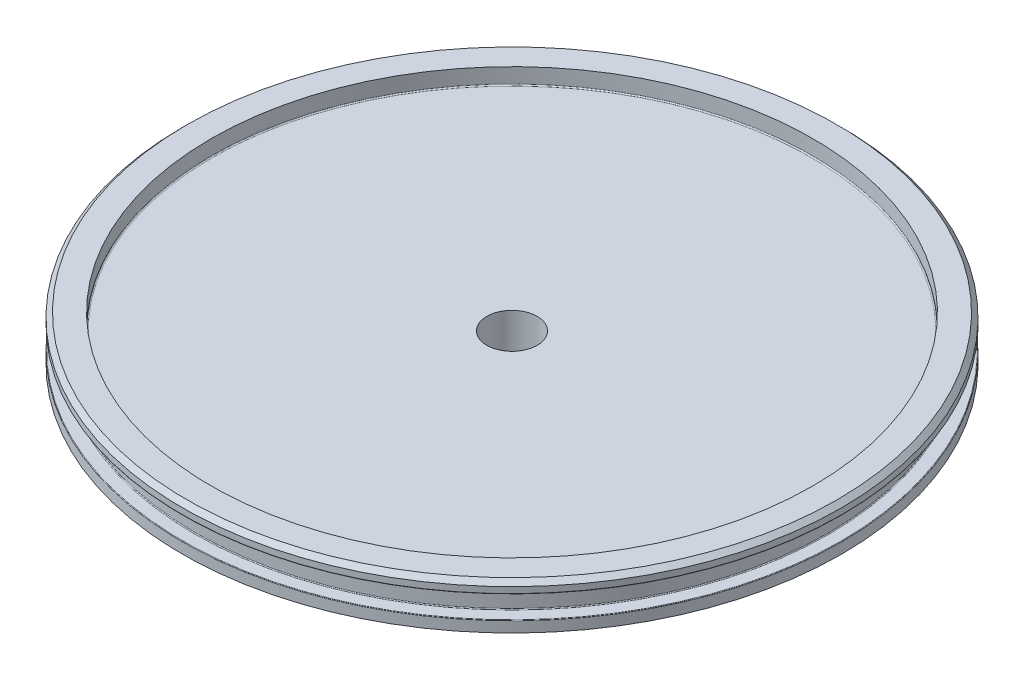
from build123d import *

# Parameters (mm, degrees)
SKETCH6_R                        = 66.04
BOSS_EXTRUDE1_DEPTH              = 2.54
PIPE_TAP_DRILL_FOR_1_4_TAP_GN2_D = 11.1252
CNC_ID_FILLET_R                  = 0.1778
CNC_OD_FILLET_R                  = 0.127
CNC_CHAMFERS_SIZE                = 1.016
CNC_BORE_FILLET_R                = 0.254


with BuildPart() as part:
    # Sketch1 → Revolve1 (revolve)
    with BuildSketch(Plane.XY):
        Polygon((0, 0), (72.898, 0), (72.898, 2.4638), (69.977, 2.4638), (69.977, 7.4422), (72.898, 7.4422), (72.898, 9.906), (66.548, 9.906), (66.548, 6.35), (0, 6.35), align=None)
    revolve(axis=Axis((0, 48.192213231, 0), (0, -1, 0)))

    # Sketch6 → Boss-Extrude1 (add)
    with BuildSketch(Plane.XZ):
        Circle(SKETCH6_R)
    extrude(amount=BOSS_EXTRUDE1_DEPTH)

    # Pipe Tap Drill for 1/4 Tap - GN2 (through all)
    with Locations(Plane(origin=(0, 6.35, 0), x_dir=(1, 0, 0), z_dir=(0, 1, 0))):
        with Locations((0, 0)):
            Hole(PIPE_TAP_DRILL_FOR_1_4_TAP_GN2_D / 2)

    # CNC ID Fillet
    cnc_id_fillet_edges = [part.edges().sort_by_distance(p)[0] for p in [
        (-69.977, 7.4422, 0),
        (-69.977, 2.4638, 0),
        (-66.04, 0, 0),
    ]]
    fillet(cnc_id_fillet_edges, radius=CNC_ID_FILLET_R)

    # CNC OD Fillet
    cnc_od_fillet_edges = [part.edges().sort_by_distance(p)[0] for p in [
        (-72.898, 7.4422, 0),
        (-72.898, 2.4638, 0),
        (-66.04, -2.54, 0),
    ]]
    fillet(cnc_od_fillet_edges, radius=CNC_OD_FILLET_R)

    # CNC Chamfers
    cnc_chamfers_edges = [part.edges().sort_by_distance(p)[0] for p in [
        (-72.898, 9.906, 0),
    ]]
    chamfer(cnc_chamfers_edges, length=CNC_CHAMFERS_SIZE)

    # CNC Bore Fillet
    cnc_bore_fillet_edges = [part.edges().sort_by_distance(p)[0] for p in [
        (-66.548, 6.35, 0),
    ]]
    fillet(cnc_bore_fillet_edges, radius=CNC_BORE_FILLET_R)


solid = part.part
